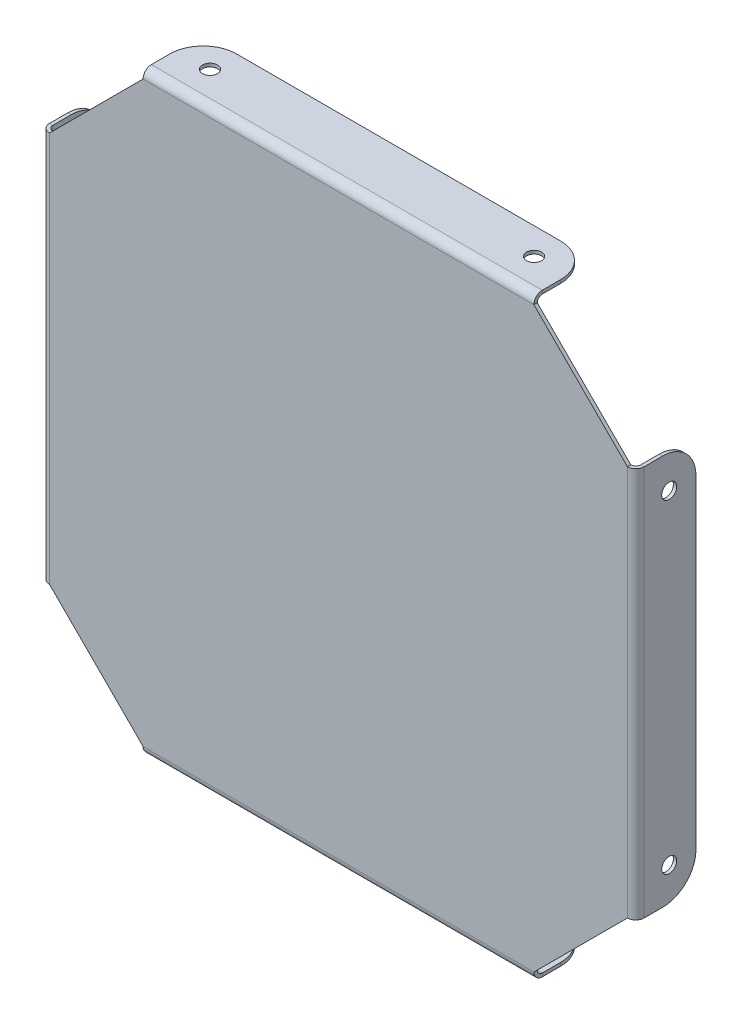
from build123d import *

# Parameters (mm, degrees)
MAIN_PLATE_DEPTH                       = 1
HORI_EDGE_DEPTH                        = 117
HORI_EDGE_FILLETS_R                    = 10
M4_CLEARANCE_HOLE1_D                   = 4.5
M4_CLEARANCE_HOLE1_DEPTH               = 178
VERT_EDGE_DEPTH                        = 117
VERT_EDGE_FILLETS_R                    = 10
M4_CLEARANCE_HOLE2_D                   = 4.5
M4_CLEARANCE_HOLE2_DEPTH               = 178
HORI_EDGE_FILLETS_OF_OTHER_HORI_EDGE_R = 10
VERT_EDGE_FILLETS_OF_OTHER_VERT_EDGE_R = 10


# Sheet-metal steps are written as plain solids
with BuildPart() as part:
    # Sketch1 → Main Plate (new body)
    with BuildSketch(Plane.XY):
        Polygon((-86.5, -58.5), (-58.5, -86.5), (58.5, -86.5), (86.5, -58.5), (86.5, 58.5), (58.5, 86.5), (-58.5, 86.5), (-86.5, 58.5), align=None)
    extrude(amount=-MAIN_PLATE_DEPTH)

    # Hori Edge section (across the edge) → Hori Edge (add)
    with BuildSketch(Plane(origin=(-58.5, 88, -1), x_dir=(0, -1, 0), z_dir=(1, 0, 0))):
        with BuildLine():
            Line((-1, 1.5), (-1, 17))
            Line((-1, 17), (0, 17))
            Line((0, 17), (0, 1.5))
            ThreePointArc((0, 1.5), (0.439339828, 0.439339828), (1.5, 0))
            Line((1.5, 0), (1.5, -1))
            ThreePointArc((1.5, -1), (-0.267766953, -0.267766953), (-1, 1.5))
        make_face()
    hori_edge = extrude(amount=HORI_EDGE_DEPTH)

    # Hori Edge Fillets
    hori_edge_fillets_edges = [part.edges().sort_by_distance(p)[0] for p in [
        (-58.5, 88.5, -18),
        (58.5, 88.5, -18),
    ]]
    fillet(hori_edge_fillets_edges, radius=HORI_EDGE_FILLETS_R)

    # M4 Clearance Hole1
    with Locations(Plane(origin=(0, 89, 0), x_dir=(1, 0, 0), z_dir=(0, 1, 0))):
        with Locations((-48.5, 10.042929808), (48.5, 10.042929808)):
            m4_clearance_hole1 = Hole(M4_CLEARANCE_HOLE1_D / 2, depth=M4_CLEARANCE_HOLE1_DEPTH)

    # Vert Edge section (across the edge) → Vert Edge (add)
    with BuildSketch(Plane(origin=(88, 58.5, -1), x_dir=(-1, 0, 0), z_dir=(0, -1, 0))):
        with BuildLine():
            Line((-1, 1.5), (-1, 17))
            Line((-1, 17), (0, 17))
            Line((0, 17), (0, 1.5))
            ThreePointArc((0, 1.5), (0.439339828, 0.439339828), (1.5, 0))
            Line((1.5, 0), (1.5, -1))
            ThreePointArc((1.5, -1), (-0.267766953, -0.267766953), (-1, 1.5))
        make_face()
    vert_edge = extrude(amount=VERT_EDGE_DEPTH)

    # Vert Edge Fillets
    vert_edge_fillets_edges = [part.edges().sort_by_distance(p)[0] for p in [
        (88.5, 58.5, -18),
        (88.5, -58.5, -18),
    ]]
    fillet(vert_edge_fillets_edges, radius=VERT_EDGE_FILLETS_R)

    # M4 Clearance Hole2
    with Locations(Plane(origin=(89, 0, 0), x_dir=(0, 0, -1), z_dir=(1, 0, 0))):
        with Locations((10, 48.5), (10, -48.5)):
            m4_clearance_hole2 = Hole(M4_CLEARANCE_HOLE2_D / 2, depth=M4_CLEARANCE_HOLE2_DEPTH)

    # Other Hori Edge: Hori Edge, M4 Clearance Hole1 across plane
    add(hori_edge.mirror(Plane.ZX))
    add(m4_clearance_hole1.mirror(Plane.ZX), mode=Mode.SUBTRACT)

    # Hori Edge Fillets of Other Hori Edge
    hori_edge_fillets_of_other_hori_edge_edges = [part.edges().sort_by_distance(p)[0] for p in [
        (-58.5, -88.5, -18),
        (58.5, -88.5, -18),
    ]]
    fillet(hori_edge_fillets_of_other_hori_edge_edges, radius=HORI_EDGE_FILLETS_OF_OTHER_HORI_EDGE_R)

    # Other Vert Edge: Vert Edge, M4 Clearance Hole2 across plane
    add(vert_edge.mirror(Plane(origin=(0, 0, 0), x_dir=(0, 0, 1), z_dir=(1, 0, 0))))
    add(m4_clearance_hole2.mirror(Plane(origin=(0, 0, 0), x_dir=(0, 0, 1), z_dir=(1, 0, 0))), mode=Mode.SUBTRACT)

    # Vert Edge Fillets of Other Vert Edge
    vert_edge_fillets_of_other_vert_edge_edges = [part.edges().sort_by_distance(p)[0] for p in [
        (-88.5, 58.5, -18),
        (-88.5, -58.5, -18),
    ]]
    fillet(vert_edge_fillets_of_other_vert_edge_edges, radius=VERT_EDGE_FILLETS_OF_OTHER_VERT_EDGE_R)


solid = part.part
